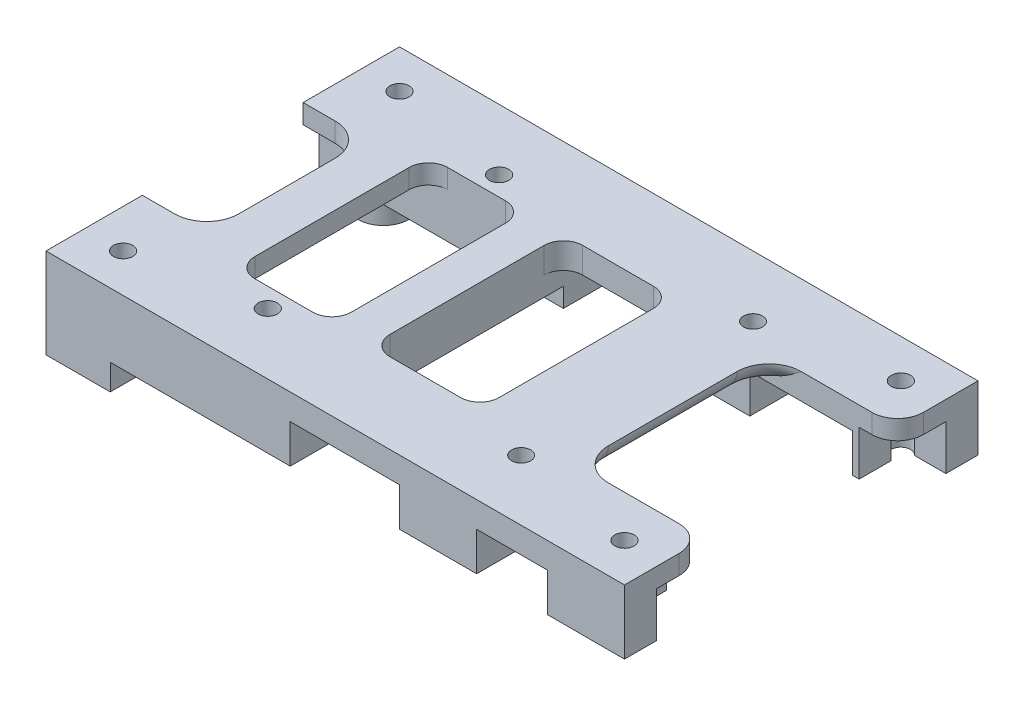
from build123d import *

# Parameters (mm, degrees)
SKETCH_1_W           = 90
SKETCH_1_H           = 55
EXTRUDE_1_DEPTH      = 10
SKETCH_2_R           = 1.5
SKETCH_2_R_2         = 1.48
CUT_EXTRUDE_1_DEPTH  = 30
SKETCH_3_W           = 80
SKETCH_3_H           = 30
SKETCH_3_W_2         = 6
SKETCH_3_H_2         = 45
CUT_EXTRUDE_2_DEPTH  = 7
SKETCH_4_R           = 1.5
CUT_EXTRUDE_3_DEPTH  = 20
SKETCH_8_W           = 10
SKETCH_8_H           = 25
SKETCH_8_W_2         = 20
SKETCH_8_H_2         = 30
CUT_EXTRUDE_6_DEPTH  = 20
SKETCH_10_W          = 11
SKETCH_10_H          = 55
SKETCH_10_W_2        = 17
CUT_EXTRUDE_8_DEPTH  = 6
FILLET_3_R           = 5
SKETCH_11_W          = 6
SKETCH_11_H          = 30
EXTRUDE_3_DEPTH      = 4
CHAMFER_3_SIZE       = 5
FILLET_7_R           = 3
SKETCH_12_W          = 15
SKETCH_12_H          = 30
SKETCH_12_W_2        = 17
CUT_EXTRUDE_9_DEPTH  = 6
FILLET_8_R           = 3
FILLET_9_R           = 4
SKETCH_13_W          = 10
SKETCH_13_H          = 12.5
EXTRUDE_4_DEPTH      = 4
FILLET_10_R          = 4
FILLET_11_R          = 4
SKETCH_14_R          = 1
CUT_EXTRUDE_10_DEPTH = 10


# Some blends are built 0.0001 mm under size
with BuildPart() as part:
    # 草图1 → 凸台-拉伸1 (new body)
    with BuildSketch(Plane(origin=(0, 0, 0), x_dir=(1, 0, 0), z_dir=(0, 1, 0))):
        Rectangle(SKETCH_1_W, SKETCH_1_H)
    extrude(amount=EXTRUDE_1_DEPTH)

    # 草图2 → 切除-拉伸1 (cut)
    with BuildSketch(Plane(origin=(0, 10, 0), x_dir=(1, 0, 0), z_dir=(0, 1, 0))):
        with Locations(Location((-20, 18, 0), (0, 0, 270))):
            Circle(SKETCH_2_R)
        with Locations(Location((-20, -18, 0), (0, 0, 270))):
            Circle(SKETCH_2_R)
        with Locations(Location((19.5, -18.075939793, 0), (0, 0, 270))):
            Circle(SKETCH_2_R_2)
        with Locations(Location((19.5, 18, 0), (0, 0, 270))):
            Circle(SKETCH_2_R_2)
    extrude(amount=-CUT_EXTRUDE_1_DEPTH, mode=Mode.SUBTRACT)

    # 草图3 → 切除-拉伸2 (cut)
    with BuildSketch(Plane.XZ):
        with Locations((-5, 0)):
            Rectangle(SKETCH_3_W, SKETCH_3_H)
        with Locations((42, 0)):
            Rectangle(SKETCH_3_W_2, SKETCH_3_H_2)
    extrude(amount=-CUT_EXTRUDE_2_DEPTH, mode=Mode.SUBTRACT)

    # 草图4 → 切除-拉伸3 (cut)
    with BuildSketch(Plane(origin=(0, 10, 0), x_dir=(1, 0, 0), z_dir=(0, 1, 0))):
        with Locations(Location((39, 21.5, 0), (0, 0, 270))):
            Circle(SKETCH_4_R)
        with Locations(Location((-39, 21.5, 0), (0, 0, 270))):
            Circle(SKETCH_4_R)
        with Locations(Location((-39, -21.5, 0), (0, 0, 270))):
            Circle(SKETCH_4_R)
        with Locations(Location((39, -21.5, 0), (0, 0, 90))):
            Circle(SKETCH_4_R)
    extrude(amount=-CUT_EXTRUDE_3_DEPTH, mode=Mode.SUBTRACT)

    # 草图8 → 切除-拉伸6 (cut)
    with BuildSketch(Plane(origin=(0, 10, 0), x_dir=(1, 0, 0), z_dir=(0, 1, 0))):
        with Locations((-40, 0)):
            Rectangle(SKETCH_8_W, SKETCH_8_H)
        with Locations((35, 0)):
            Rectangle(SKETCH_8_W_2, SKETCH_8_H_2)
    extrude(amount=-CUT_EXTRUDE_6_DEPTH, mode=Mode.SUBTRACT)

    # 草图10 → 切除-拉伸8 (cut)
    with BuildSketch(Plane.XZ):
        with Locations((27.5, 0)):
            Rectangle(SKETCH_10_W, SKETCH_10_H)
        with Locations((1.5, 0)):
            Rectangle(SKETCH_10_W_2, SKETCH_10_H)
    extrude(amount=-CUT_EXTRUDE_8_DEPTH, mode=Mode.SUBTRACT)

    # 圆角3
    fillet_3_edges = [part.edges().sort_by_distance(p)[0] for p in [
        (-35, 8.5, -12.5),
        (-35, 8.5, 12.5),
        (25, 8.5, 15),
        (25, 8.5, -15),
    ]]
    fillet(fillet_3_edges, radius=FILLET_3_R)

    # 草图11 → 凸台-拉伸3 (add)
    with BuildSketch(Plane.XZ.offset(-7)):
        with Locations((-10, 0)):
            Rectangle(SKETCH_11_W, SKETCH_11_H)
        with Locations((13, 0)):
            Rectangle(SKETCH_11_W, SKETCH_11_H)
    extrude(amount=EXTRUDE_3_DEPTH)

    # 倒角3
    chamfer_3_edges = [part.edges().sort_by_distance(p)[0] for p in [
        (33, 3, 15),
        (33, 3, -15),
    ]]
    chamfer(chamfer_3_edges, length=CHAMFER_3_SIZE)

    # 圆角7
    # the kernel refuses this fillet: 3 mm, written as the material it takes off along each edge
    with BuildSketch(Plane(origin=(25, 7, 10), x_dir=(0, 1, 0), z_dir=(0, 0, -1))) as fillet_7_piece_1:
        with BuildLine():
            CenterArc((FILLET_7_R, -FILLET_7_R), FILLET_7_R, 90, 90)
            Line((0, -FILLET_7_R), (0, 0))
            Line((0, 0), (FILLET_7_R, 0))
        make_face()
    extrude(amount=20, mode=Mode.SUBTRACT)
    with BuildSketch(Plane(origin=(30, 7, 10), x_dir=(0.9975374290817743, 0, 0.0701361360564157), z_dir=(0.0701361360564157, 0, -0.9975374290817743))) as fillet_7_piece_2_section:
        with BuildLine():
            CenterArc((5 + FILLET_7_R, -FILLET_7_R), FILLET_7_R, 90, 90)
            Line((5 + FILLET_7_R, 0), (5, 0))
            Line((5, 0), (5, -FILLET_7_R))
        make_face()
    fillet_7_piece_2 = revolve(axis=Axis((30, 7, 10), (0, -1, 0)), revolution_arc=175.978193542, mode=Mode.PRIVATE)
    fillet_7_piece_2 = split(fillet_7_piece_2, bisect_by=Plane(origin=(26.314129742, 7.843114036, 15), z_dir=(0, 0, -1)), keep=Keep.TOP, mode=Mode.PRIVATE)
    add(fillet_7_piece_2, mode=Mode.SUBTRACT)
    with BuildSketch(Plane(origin=(30, 7, -10), x_dir=(0.9975374290817743, 0, -0.0701361360564157), z_dir=(0.0701361360564157, 0, 0.9975374290817743))) as fillet_7_piece_3_section:
        with BuildLine():
            CenterArc((5 + FILLET_7_R, FILLET_7_R), FILLET_7_R, 180, 90)
            Line((5 + FILLET_7_R, 0), (5, 0))
            Line((5, 0), (5, FILLET_7_R))
        make_face()
    fillet_7_piece_3 = revolve(axis=Axis((30, 7, -10), (0, 1, 0)), revolution_arc=175.978193542, mode=Mode.PRIVATE)
    fillet_7_piece_3 = split(fillet_7_piece_3, bisect_by=Plane(origin=(26.31413004, 7.843114018, -15), z_dir=(0, 0, 1)), keep=Keep.TOP, mode=Mode.PRIVATE)
    add(fillet_7_piece_3, mode=Mode.SUBTRACT)

    # 草图12 → 切除-拉伸9 (cut)
    with BuildSketch(Plane.XZ.offset(-7)):
        with Locations((-20.5, 0)):
            Rectangle(SKETCH_12_W, SKETCH_12_H)
        with Locations((1.5, 0)):
            Rectangle(SKETCH_12_W_2, SKETCH_12_H)
    extrude(amount=-CUT_EXTRUDE_9_DEPTH, mode=Mode.SUBTRACT)

    # 圆角8
    fillet_8_edges = [part.edges().sort_by_distance(p)[0] for p in [
        (-7, 8, -15),
        (-7, 8, 15),
        (-13, 6.5, 15),
        (-13, 6.5, -15),
        (10, 8, 15),
        (10, 8, -15),
        (-28, 8.5, -15),
        (-28, 8.5, 15),
    ]]
    fillet(fillet_8_edges, radius=FILLET_8_R)

    # 圆角9
    fillet_9_edges = [part.edges().sort_by_distance(p)[0] for p in [
        (16, 7, 0),
    ]]
    fillet(fillet_9_edges, radius=FILLET_9_R - 0.0001)  # a hair under: the kernel refuses the full size

    # 草图13 → 凸台-拉伸4 (add)
    with BuildSketch(Plane.XZ):
        with Locations((-40, 21.25)):
            Rectangle(SKETCH_13_W, SKETCH_13_H)
        with Locations((-40, -21.25)):
            Rectangle(SKETCH_13_W, SKETCH_13_H)
    extrude(amount=EXTRUDE_4_DEPTH)

    # 圆角10
    fillet_10_edges = [part.edges().sort_by_distance(p)[0] for p in [
        (-35, -2, 15),
        (-35, -2, -15),
    ]]
    fillet(fillet_10_edges, radius=FILLET_10_R)

    # 圆角11
    fillet_11_edges = [part.edges().sort_by_distance(p)[0] for p in [
        (45, 8.5, 15),
        (45, 8.5, -15),
    ]]
    fillet(fillet_11_edges, radius=FILLET_11_R)

    # 草图14 → 切除-拉伸10 (cut)
    with BuildSketch(Plane(origin=(0, 0, -27.5), x_dir=(-1, 0, 0), z_dir=(0, 0, -1))):
        with Locations((-28, 8)):
            Circle(SKETCH_14_R)
        with Locations((7, 8)):
            Circle(SKETCH_14_R)
    extrude(amount=-CUT_EXTRUDE_10_DEPTH, mode=Mode.SUBTRACT)


solid = part.part
